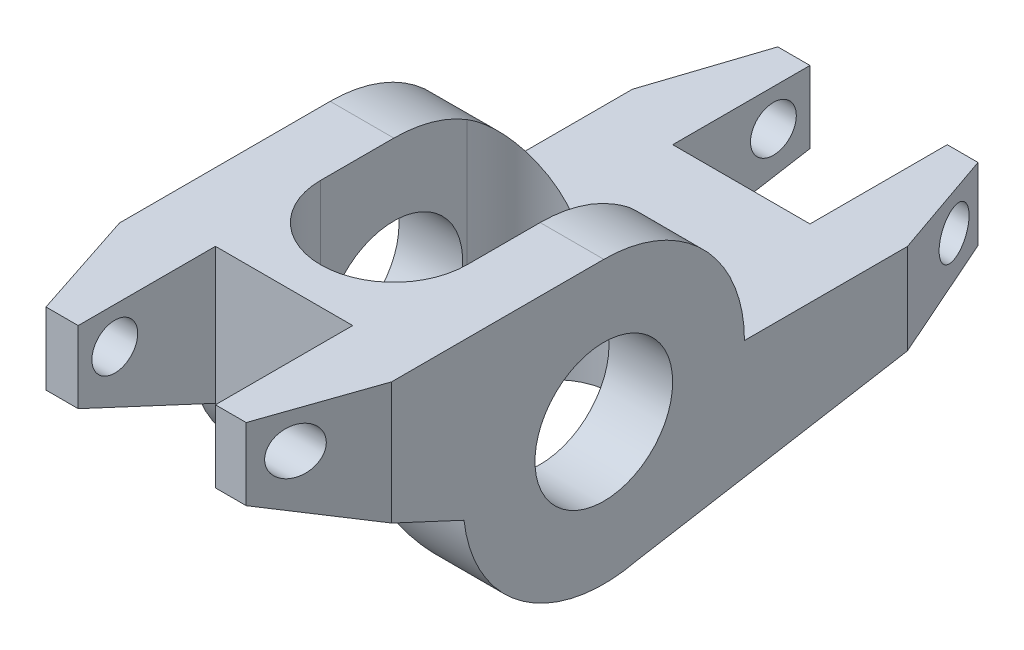
from build123d import *

# Parameters (mm, degrees)
SKETCH1_R               = 4.78
BOSS_EXTRUDE1_DEPTH     = 9.5
CUT_EXTRUDE1_DEPTH      = 32.661042702
CUT_EXTRUDE1_DEPTH_BACK = 32.661042702
SKETCH2_W               = 9.53
SKETCH2_H               = 9.53
CUT_EXTRUDE2_DEPTH      = 32.661042763
CUT_EXTRUDE2_DEPTH_BACK = 32.661042763
SKETCH3_R               = 1.59
CHAMFER1_SIZE           = 7.5
CHAMFER1_SIZE_2         = 2.6
CHAMFER2_SIZE           = 2.5
CHAMFER2_SIZE_2         = 7.6


with BuildPart() as part:
    # Sketch1 → Boss-Extrude1 (new, symmetric)
    with BuildSketch(Plane(origin=(0, 0, 0), x_dir=(0, 0, -1), z_dir=(1, 0, 0))):
        with BuildLine():
            Line((9.765, 0), (28.58, 0))
            Line((28.58, 0), (28.58, -5))
            Line((28.58, -5), (2.273512356, -9.496650281))
            ThreePointArc((2.273512356, -9.496650281), (-5.618124367, -7.986983385), (-9.706200338, -1.07))
            Line((-9.706200338, -1.07), (-22.23, 4.765))
            Line((-22.23, 4.765), (-22.23, 9.765))
            Line((-22.23, 9.765), (0, 9.765))
            ThreePointArc((0, 9.765), (6.904897718, 6.904897718), (9.765, 0))
        make_face()
        Circle(SKETCH1_R, mode=Mode.SUBTRACT)
    extrude(amount=BOSS_EXTRUDE1_DEPTH, both=True)

    # Sketch2 → Cut-Extrude1 (cut, two sides: drawn at the far end of the back side and taken through both)
    with BuildSketch(Plane(origin=(0, 0, 0), x_dir=(1, 0, 0), z_dir=(0, 1, 0)).offset(-CUT_EXTRUDE1_DEPTH_BACK)):
        with Locations((0, 23.815)):
            Rectangle(SKETCH2_W, SKETCH2_H)
        with BuildLine():
            Line((5.08, 5.08), (5.08, -5.08))
            ThreePointArc((5.08, -5.08), (0, -10.16), (-5.08, -5.08))
            Line((-5.08, -5.08), (-5.08, 5.08))
            ThreePointArc((-5.08, 5.08), (0, 10.16), (5.08, 5.08))
        make_face()
        with Locations((0, -17.465)):
            Rectangle(SKETCH2_W, SKETCH2_H)
    extrude(amount=CUT_EXTRUDE1_DEPTH + CUT_EXTRUDE1_DEPTH_BACK, mode=Mode.SUBTRACT)

    # Sketch3 → Cut-Extrude2 (cut, two sides: drawn at the far end of the back side and taken through both)
    with BuildSketch(Plane(origin=(0, 0, 0), x_dir=(0, 0, -1), z_dir=(1, 0, 0)).offset(-CUT_EXTRUDE2_DEPTH_BACK)):
        with Locations((-19.69, 7.225)):
            Circle(SKETCH3_R)
        with Locations((26.04, -2.54)):
            Circle(SKETCH3_R)
    extrude(amount=CUT_EXTRUDE2_DEPTH + CUT_EXTRUDE2_DEPTH_BACK, mode=Mode.SUBTRACT)

    # Chamfer1
    # the kernel refuses this chamfer: 7.5, 2.6 mm, written as the material it takes off along each edge
    with BuildSketch(Plane(origin=(9.5, -14.695177751, 22.23), x_dir=(0.01262359546550246, 0, -0.9999203192442502), z_dir=(0, 1, 0)), Plane(origin=(9.5, 19.460177751, -28.58), x_dir=(0.012623595465502456, 0, 0.9999203192442502), z_dir=(0, -1, 0))) as chamfer1_piece_1:
        Polygon((CHAMFER1_SIZE * 0.999920319244, CHAMFER1_SIZE * 0.0126235954655), (-CHAMFER1_SIZE_2 * 0.0126235954655, CHAMFER1_SIZE_2 * 0.999920319244), (0, 0), align=None)
    extrude(amount=43.920355501, mode=Mode.SUBTRACT)

    # Chamfer2
    # the kernel refuses this chamfer: 7.6, 2.5 mm, written as the material it takes off along each edge
    with BuildSketch(Plane(origin=(-9.5, -14.958373363, 22.23), x_dir=(0.9938650173465227, 0, 0.11059985214635677), z_dir=(0, 1, 0))) as chamfer2_piece_1:
        Polygon((CHAMFER2_SIZE * 0.993865017347, CHAMFER2_SIZE * 0.110599852146), (-CHAMFER2_SIZE_2 * 0.110599852146, CHAMFER2_SIZE_2 * 0.993865017347), (0, 0), align=None)
    extrude(amount=44.446746726, mode=Mode.SUBTRACT)
    with BuildSketch(Plane(origin=(-9.5, 19.723373363, -28.58), x_dir=(-0.012040610047615204, 0, 0.9999275092273846), z_dir=(0, -1, 0))) as chamfer2_piece_2:
        Polygon((CHAMFER2_SIZE_2 * 0.999927509227, -CHAMFER2_SIZE_2 * 0.0120406100476), (-CHAMFER2_SIZE * 0.0120406100476, -CHAMFER2_SIZE * 0.999927509227), (0, 0), align=None)
    extrude(amount=44.446746726, mode=Mode.SUBTRACT)


solid = part.part
